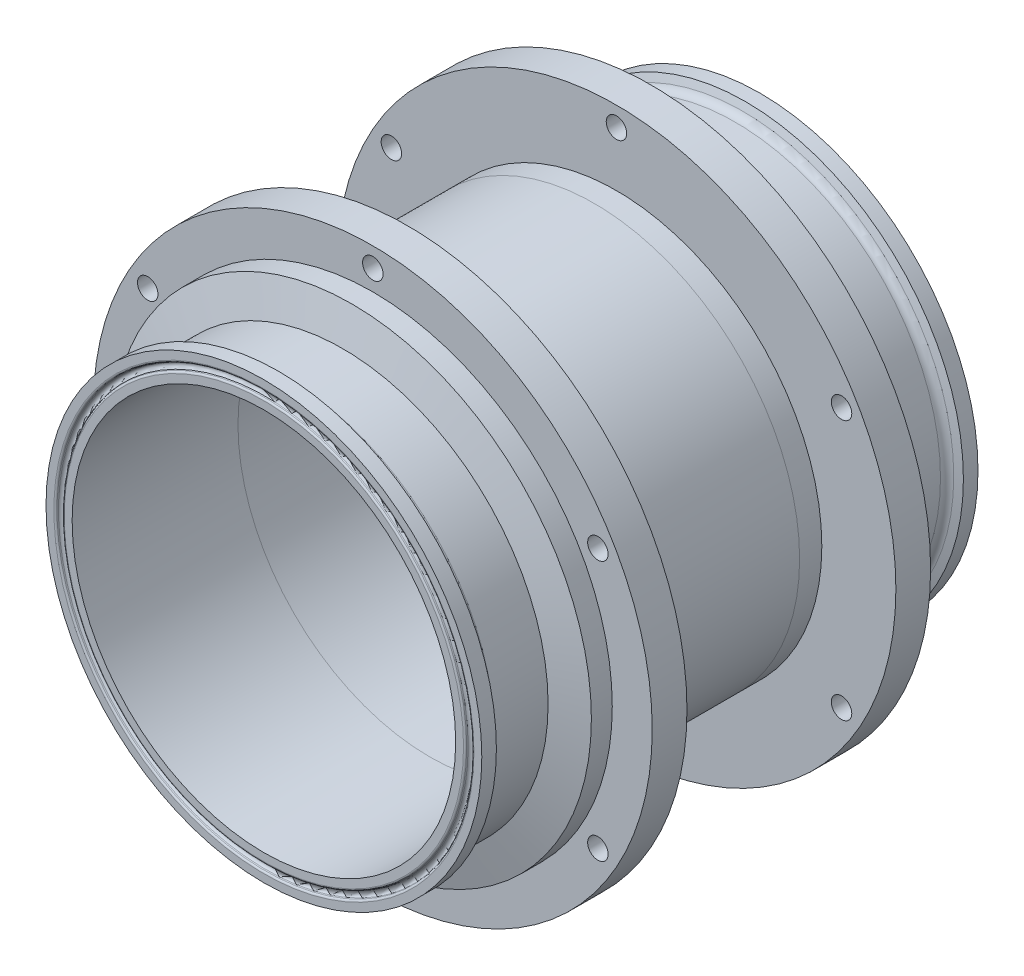
from build123d import *

# Parameters (mm, degrees)
SKETCH2_R               = 78.6384
SKETCH2_R_2             = 73.4314
BOSS_EXTRUDE1_DEPTH     = 31.5
MIRROR2_START           = -126.5
MIRROR2_OUTLINE_R       = 78.6384
MIRROR2_OUTLINE_R_2     = 73.4314
MIRROR2_DEPTH           = 31.5
CUT_EXTRUDE1_DEPTH      = 212.87470354
CUT_EXTRUDE1_DEPTH_BACK = 212.87470354
SKETCH3_R               = 3.919672831


# Read off the part's stored shape, not the designer's step: Mirror2
with BuildPart() as part:
    # Sketch1 → Revolve1 (revolve)
    with BuildSketch(Plane(origin=(0, 0, 0), x_dir=(0, 0, -1), z_dir=(1, 0, 0)), mode=Mode.PRIVATE) as revolve1_sk:
        with BuildLine():
            Line((0, 73.4314), (0, 76.444627725))
            ThreePointArc((0, 76.444627725), (0.130798304, 76.879222907), (0.479738309, 77.169433247))
            Line((0.479738309, 77.169433247), (0.872854821, 77.336301306))
            ThreePointArc((0.872854821, 77.336301306), (1.6002, 78.4352), (0.872854821, 79.534098694))
            Line((0.872854821, 79.534098694), (0.479738309, 79.700966753))
            ThreePointArc((0.479738309, 79.700966753), (0.130798304, 79.991177093), (0, 80.425772275))
            Line((0, 80.425772275), (0, 83.439))
            Line((0, 83.439), (5.588, 83.439))
            Line((5.588, 83.439), (6.574910369, 80.727486045))
            ThreePointArc((6.574910369, 80.727486045), (7.737329255, 79.212592259), (9.55843444, 78.6384))
            Line((9.55843444, 78.6384), (30.185190067, 78.6384))
            Line((30.185190067, 78.6384), (33.7, 91.7))
            Line((33.7, 91.7), (41.7, 91.7))
            Line((41.7, 91.7), (41.7, 107))
            Line((41.7, 107), (55, 107))
            Line((55, 107), (55, 78.6384))
            Line((55, 78.6384), (63.5, 78.6384))
            Line((63.5, 78.6384), (63.5, 73.4314))
            Line((63.5, 73.4314), (0, 73.4314))
        make_face()
    revolve(revolve1_sk.sketch.rotate(Axis((0, 0, 0), (0, 0, -1)), 90), axis=Axis((0, 0, 0), (0, 0, -1)))


with BuildPart() as body_2:
    # Sketch2 → Boss-Extrude1 (new body)
    with BuildSketch(Plane(origin=(0, 0, -63.5), x_dir=(-1, 0, 0), z_dir=(0, 0, -1))):
        with Locations(Location((0, 0, 0), (0, 0, 180))):
            Circle(SKETCH2_R)
        with Locations(Location((0, 0, 0), (0, 0, 180))):
            Circle(SKETCH2_R_2, mode=Mode.SUBTRACT)
    extrude(amount=BOSS_EXTRUDE1_DEPTH)

    # Mirror2 outline → Mirror2 (add)
    with BuildSketch(Plane.XY.offset(MIRROR2_START)):
        Circle(MIRROR2_OUTLINE_R)
        Circle(MIRROR2_OUTLINE_R_2, mode=Mode.SUBTRACT)
    extrude(amount=MIRROR2_DEPTH)


with BuildPart() as body_3:
    # Mirror4: mirrored copy
    add(part.part.mirror(Plane(origin=(0, 0, -95), x_dir=(1, 0, 0), z_dir=(0, 0, -1))))


with BuildPart() as cut_extrude1_tool:
    # Sketch3 → Cut-Extrude1 (new, two sides: drawn at the far end of the back side and taken through both)
    with BuildSketch(Plane.XY.offset(-41.7).offset(-CUT_EXTRUDE1_DEPTH_BACK)):
        with Locations((0, 99.516286802)):
            Circle(SKETCH3_R)
        with Locations((86.183632461, 49.758143401)):
            Circle(SKETCH3_R)
        with Locations((86.183632461, -49.758143401)):
            Circle(SKETCH3_R)
        with Locations((0, -99.516286802)):
            Circle(SKETCH3_R)
        with Locations((-86.183632461, -49.758143401)):
            Circle(SKETCH3_R)
        with Locations((-86.183632461, 49.758143401)):
            Circle(SKETCH3_R)
    extrude(amount=CUT_EXTRUDE1_DEPTH + CUT_EXTRUDE1_DEPTH_BACK)


with BuildPart() as part_1:
    add(part.part)

    # Cut-Extrude1: cut by cut_extrude1_tool
    add(cut_extrude1_tool.part, mode=Mode.SUBTRACT)


with BuildPart() as body_3_1:
    add(body_3.part)

    # Cut-Extrude1: cut by cut_extrude1_tool
    add(cut_extrude1_tool.part, mode=Mode.SUBTRACT)


solid = Compound([body_2.part, part_1.part, body_3_1.part])
